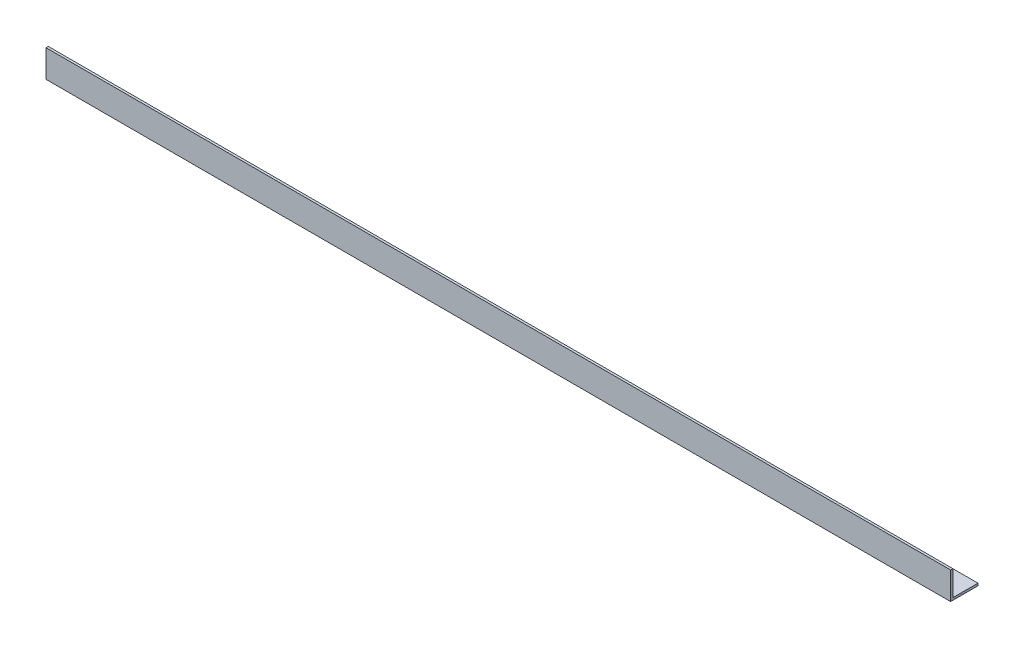
from build123d import *

# Parameters (mm, degrees)
EXTRUDE_THIN1_DEPTH = 628.65


with BuildPart() as part:
    # Sketch1 → Extrude-Thin1 (new body)
    with BuildSketch(Plane(origin=(0, 0, 0), x_dir=(0, 0, -1), z_dir=(1, 0, 0))):
        Polygon((0, 19.05), (0, 0), (19.05, 0), (19.05, 1.5875), (1.5875, 1.5875), (1.5875, 19.05), align=None)
    extrude(amount=EXTRUDE_THIN1_DEPTH)


solid = part.part
